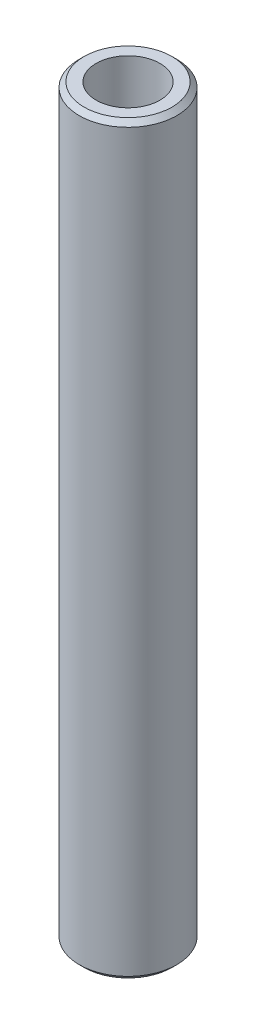
from build123d import *

# Parameters (mm, degrees)
SKETCH1_R           = 22.5
BOSS_EXTRUDE1_DEPTH = 343.356689763
SKETCH2_R           = 14.706203314
CUT_EXTRUDE1_DEPTH  = 345.827951891
CHAMFER1_SIZE       = 2.262486711


with BuildPart() as part:
    # Sketch1 → Boss-Extrude1 (new body)
    with BuildSketch(Plane(origin=(0, 0, 0), x_dir=(1, 0, 0), z_dir=(0, 1, 0))):
        Circle(SKETCH1_R)
    extrude(amount=BOSS_EXTRUDE1_DEPTH)

    # Sketch2 → Cut-Extrude1 (cut, through all)
    with BuildSketch(Plane(origin=(0, 0, 0), x_dir=(1, 0, 0), z_dir=(0, 1, 0))):
        Circle(SKETCH2_R)
    extrude(amount=CUT_EXTRUDE1_DEPTH, mode=Mode.SUBTRACT)

    # Chamfer1
    chamfer1_edges = [part.edges().sort_by_distance(p)[0] for p in [
        (-22.5, 343.356689763, 0),
        (-22.5, 0, 0),
    ]]
    chamfer(chamfer1_edges, length=CHAMFER1_SIZE)


solid = part.part
